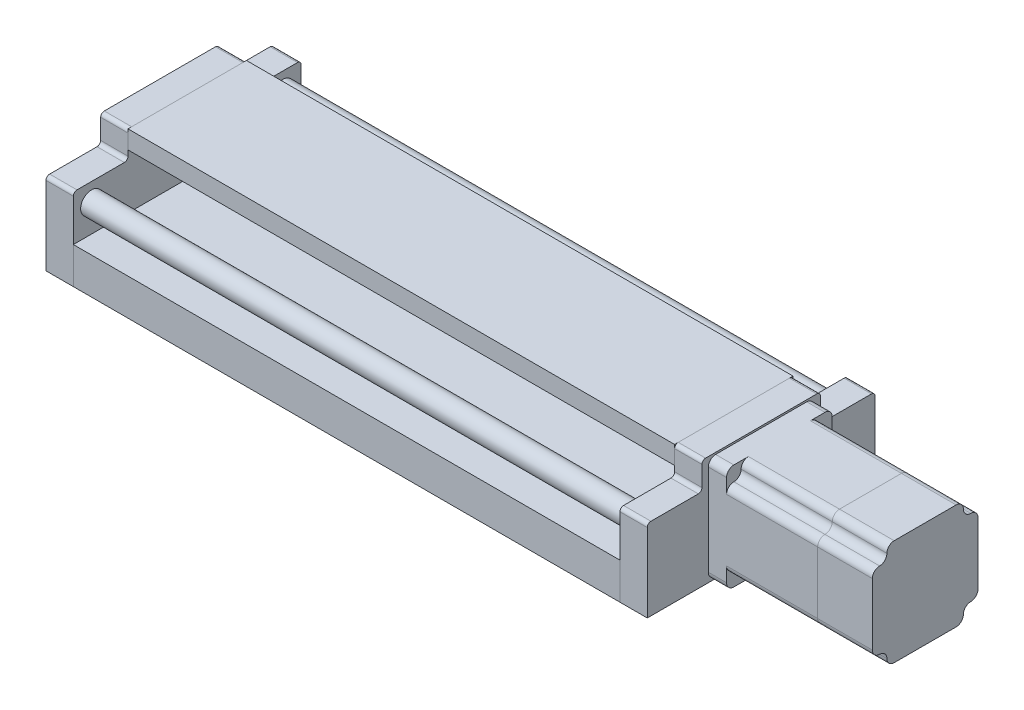
from build123d import *

# Parameters (mm, degrees)
SKETCH1_W           = 300
SKETCH1_H           = 125
BOSS_EXTRUDE1_DEPTH = 20
SKETCH2_W           = 125
SKETCH2_H           = 20
BOSS_EXTRUDE2_DEPTH = 15
SKETCH3_R           = 6
BOSS_EXTRUDE3_DEPTH = 300
SKETCH4_W           = 58
SKETCH4_H           = 58
BOSS_EXTRUDE4_DEPTH = 10
BOSS_EXTRUDE5_DEPTH = 50
BOSS_EXTRUDE6_DEPTH = 30
SKETCH7_W           = 65
SKETCH7_H           = 10
BOSS_EXTRUDE7_DEPTH = 300
FILLET1_R           = 2
FILLET2_R           = 2
FILLET3_R           = 4
FILLET4_R           = 4


with BuildPart() as part:
    # Sketch1 → Boss-Extrude1 (new body)
    with BuildSketch(Plane(origin=(0, 0, 0), x_dir=(1, 0, 0), z_dir=(0, 1, 0))):
        Rectangle(SKETCH1_W, SKETCH1_H)
    extrude(amount=BOSS_EXTRUDE1_DEPTH)


with BuildPart() as body_2:
    # Sketch2 → Boss-Extrude2 (new body)
    with BuildSketch(Plane(origin=(150, 0, 0), x_dir=(0, 0, -1), z_dir=(1, 0, 0))):
        Polygon((62.5, 45), (62.5, 20), (-62.5, 20), (-62.5, 45), (-32.5, 45), (-32.5, 60), (32.5, 60), (32.5, 45), align=None)
        with Locations((0, 10)):
            Rectangle(SKETCH2_W, SKETCH2_H)
    extrude(amount=BOSS_EXTRUDE2_DEPTH)


with BuildPart() as body_3:
    # Mirror1: mirrored copy
    add(body_2.part.mirror(Plane(origin=(0, 0, 0), x_dir=(0, 0, 1), z_dir=(1, 0, 0))))

    # Fillet1
    fillet1_edges = [body_3.edges().sort_by_distance(p)[0] for p in [
        (-157.5, 45, 62.5),
        (-157.5, 45, 32.5),
        (-157.5, 60, 32.5),
        (-157.5, 60, -32.5),
        (-157.5, 45, -32.5),
        (-157.5, 45, -62.5),
    ]]
    fillet(fillet1_edges, radius=FILLET1_R)


with BuildPart() as body_4:
    # Sketch3 → Boss-Extrude3 (new body)
    with BuildSketch(Plane(origin=(-150, 0, 0), x_dir=(0, 0, -1), z_dir=(1, 0, 0))):
        with Locations((-52.5, 35)):
            Circle(SKETCH3_R)
    extrude(amount=BOSS_EXTRUDE3_DEPTH)


with BuildPart() as body_5:
    # Mirror2: mirrored copy
    add(body_4.part.mirror(Plane.XY))


with BuildPart() as body_2_1:
    add(body_2.part)

    # Sketch4 → Boss-Extrude4 (add)
    with BuildSketch(Plane(origin=(165, 0, 0), x_dir=(0, 0, -1), z_dir=(1, 0, 0))):
        with Locations((0, 30)):
            Rectangle(SKETCH4_W, SKETCH4_H)
    extrude(amount=BOSS_EXTRUDE4_DEPTH)

    # Sketch5 → Boss-Extrude5 (add)
    with BuildSketch(Plane(origin=(175, 0, 0), x_dir=(0, 0, -1), z_dir=(1, 0, 0))):
        Polygon((21, 59), (-21, 59), (-21, 51), (-29, 51), (-29, 9), (-21, 9), (-21, 1), (21, 1), (21, 9), (29, 9), (29, 51), (21, 51), align=None)
    extrude(amount=BOSS_EXTRUDE5_DEPTH)

    # Fillet2
    fillet2_edges = [body_2_1.edges().sort_by_distance(p)[0] for p in [
        (157.5, 45, 62.5),
        (157.5, 45, 32.5),
        (157.5, 60, 32.5),
        (157.5, 60, -32.5),
        (157.5, 45, -32.5),
        (157.5, 45, -62.5),
    ]]
    fillet(fillet2_edges, radius=FILLET2_R)

    # Fillet3
    fillet3_edges = [body_2_1.edges().sort_by_distance(p)[0] for p in [
        (170, 1, 29),
        (170, 1, -29),
        (170, 59, 29),
        (170, 59, -29),
        (200, 51, -21),
        (200, 9, -21),
        (200, 9, 21),
        (200, 51, 21),
        (200, 9, 29),
        (200, 1, 21),
        (200, 1, -21),
        (200, 9, -29),
        (200, 51, -29),
        (200, 59, -21),
        (200, 51, 29),
        (200, 59, 21),
    ]]
    fillet(fillet3_edges, radius=FILLET3_R - 0.0001)  # a hair under: the kernel refuses the full size


with BuildPart() as body_6:
    # Sketch6 → Boss-Extrude6 (new body)
    with BuildSketch(Plane(origin=(225, 0, 0), x_dir=(0, 0, -1), z_dir=(1, 0, 0))):
        Polygon((-29, 9), (-21, 9), (-21, 1), (21, 1), (21, 9), (29, 9), (29, 51), (21, 51), (21, 59), (-21, 59), (-21, 51), (-29, 51), align=None)
    extrude(amount=BOSS_EXTRUDE6_DEPTH)

    # Fillet4
    fillet4_edges = [body_6.edges().sort_by_distance(p)[0] for p in [
        (240, 1, -21),
        (240, 51, 29),
        (240, 9, 29),
        (240, 1, 21),
        (240, 9, -29),
        (240, 51, -29),
        (240, 59, -21),
        (240, 59, 21),
        (240, 9, -21),
        (240, 9, 21),
        (240, 51, -21),
        (240, 51, 21),
    ]]
    fillet(fillet4_edges, radius=FILLET4_R - 0.0001)  # a hair under: the kernel refuses the full size


with BuildPart() as body_7:
    # Sketch7 → Boss-Extrude7 (new body)
    with BuildSketch(Plane(origin=(-150, 0, 0), x_dir=(0, 0, -1), z_dir=(1, 0, 0))):
        with Locations((0, 55)):
            Rectangle(SKETCH7_W, SKETCH7_H)
    extrude(amount=BOSS_EXTRUDE7_DEPTH)


solid = Compound([part.part, body_3.part, body_4.part, body_5.part, body_2_1.part, body_6.part, body_7.part])
